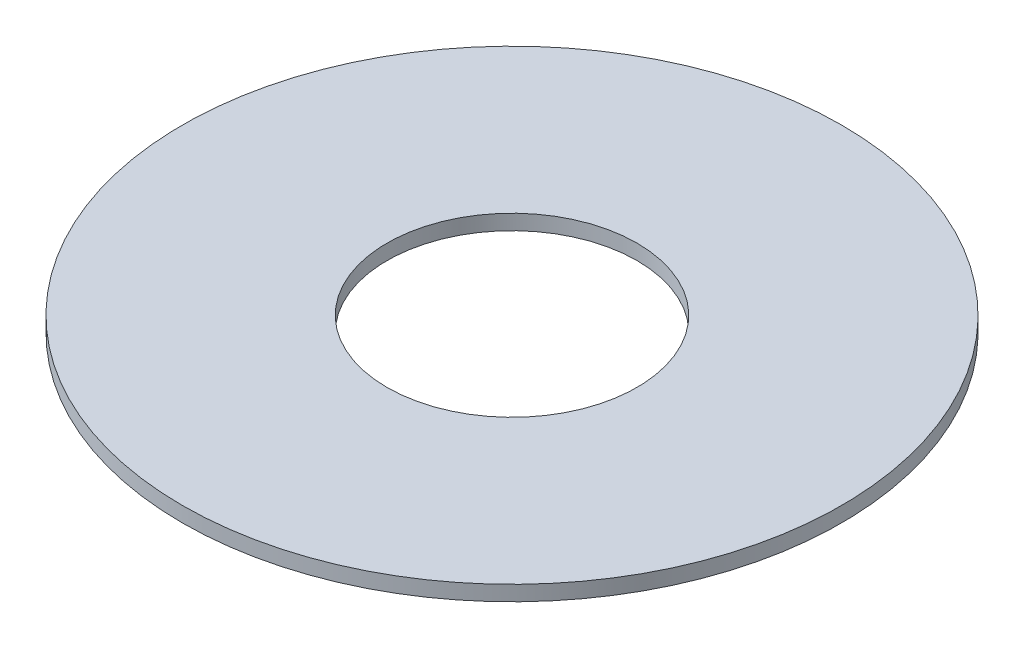
from build123d import *

# Parameters (mm, degrees)
SKETCH1_R           = 43.5
SKETCH1_R_2         = 16.5
BOSS_EXTRUDE1_DEPTH = 2


with BuildPart() as part:
    # Sketch1 → Boss-Extrude1 (new body)
    with BuildSketch(Plane(origin=(0, 0, 0), x_dir=(1, 0, 0), z_dir=(0, 1, 0))):
        Circle(SKETCH1_R)
        Circle(SKETCH1_R_2, mode=Mode.SUBTRACT)
    extrude(amount=BOSS_EXTRUDE1_DEPTH)


solid = part.part
